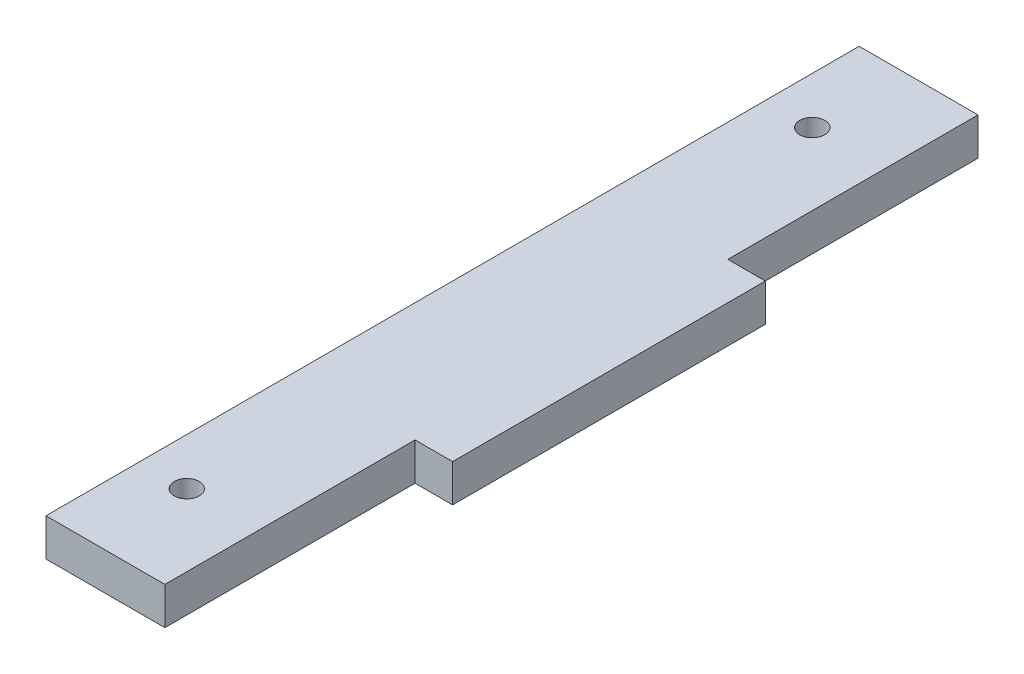
from build123d import *

# Parameters (mm, degrees)
BOSS_EXTRUDE1_DEPTH = 6
SKETCH2_R           = 2
CUT_EXTRUDE1_DEPTH  = 73.941045694


with BuildPart() as part:
    # Sketch1 → Boss-Extrude1 (new body)
    with BuildSketch(Plane(origin=(0, 0, 0), x_dir=(1, 0, 0), z_dir=(0, 1, 0))):
        Polygon((4.371579812, 18.793220339), (4.371579812, 58.793220339), (-14.628420188, 58.793220339), (-14.628420188, -71.206779661), (4.371579812, -71.206779661), (4.371579812, -31.206779661), (10.371579812, -31.206779661), (10.371579812, 18.793220339), align=None)
    extrude(amount=BOSS_EXTRUDE1_DEPTH)

    # Sketch2 → Cut-Extrude1 (cut, through all)
    with BuildSketch(Plane(origin=(0, 6, 0), x_dir=(1, 0, 0), z_dir=(0, 1, 0))):
        with Locations((-7.128420188, -56.206779661)):
            Circle(SKETCH2_R)
        with Locations((-7.128420188, 43.793220339)):
            Circle(SKETCH2_R)
    extrude(amount=-CUT_EXTRUDE1_DEPTH, mode=Mode.SUBTRACT)


solid = part.part
